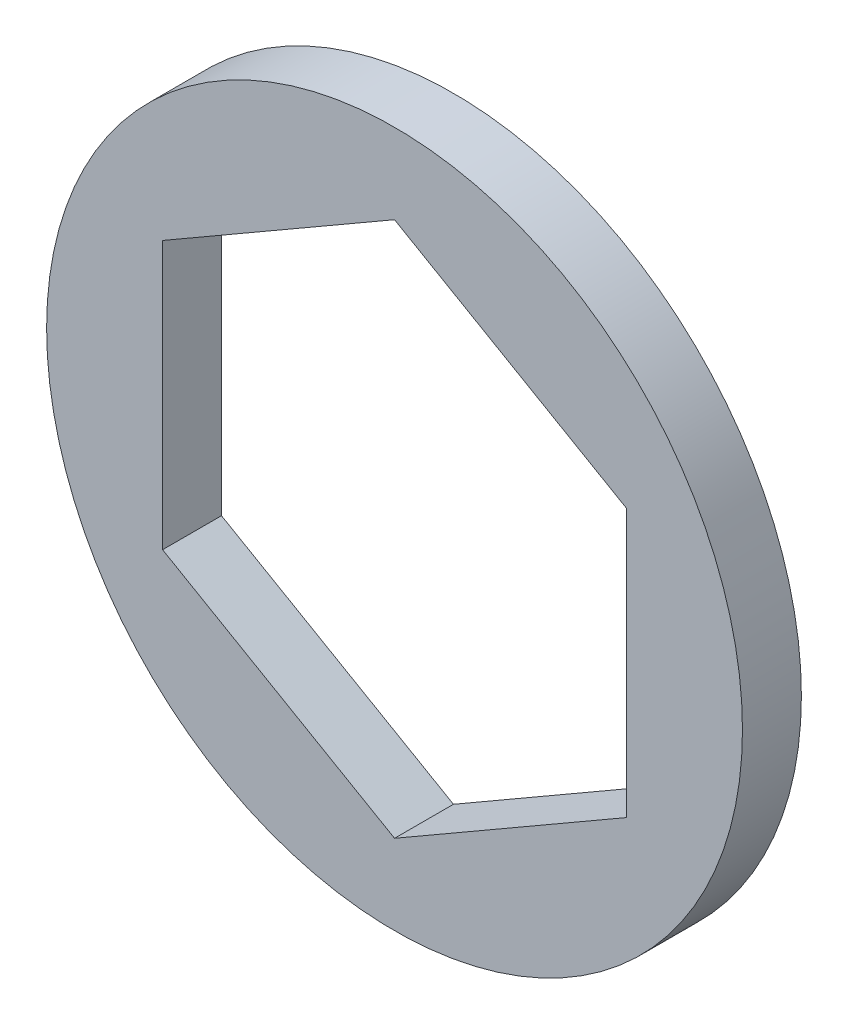
from build123d import *

# Parameters (mm, degrees)
SKETCH1_R           = 9.525
BOSS_EXTRUDE1_DEPTH = 1.6129


with BuildPart() as part:
    # Sketch1 → Boss-Extrude1 (new body)
    with BuildSketch(Plane.XY):
        Circle(SKETCH1_R)
        Polygon((0, 7.332348419), (-6.35, 3.666174209), (-6.35, -3.666174209), (0, -7.332348419), (6.35, -3.666174209), (6.35, 3.666174209), align=None, mode=Mode.SUBTRACT)
    extrude(amount=BOSS_EXTRUDE1_DEPTH)


solid = part.part
